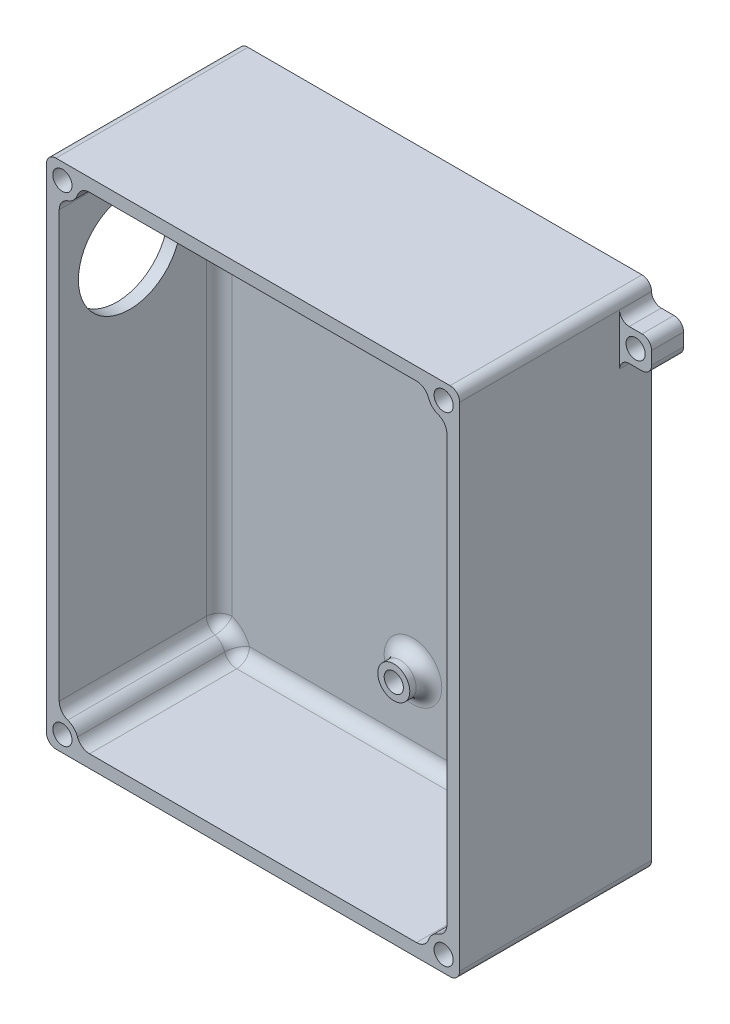
from build123d import *

# Parameters (mm, degrees)
SKETCH1_R          = 2.499999999999999
SKETCH1_W          = 60.58456356151953
SKETCH1_H          = 76
SKETCH1_R_2        = 1.5000000000000024
SKETCH1_R_3        = 1.5000000000000042
SKETCH1_R_4        = 2.500000000000004
BASE_DEPTH         = 5
WALLS_START        = 5
WALLS_DEPTH        = 25
STANDOFFS_START    = 5
SKETCH1_5_R        = 2.500000000000004
SKETCH1_5_R_2      = 1.5000000000000024
STANDOFFS_DEPTH    = 3
EXTERNAL_FILLET_R  = 1.5
INTERNAL_FILLET_R  = 2
SKETCH3_R          = 8.000000000000002
CUT_EXTRUDE2_DEPTH = 2


with BuildPart() as part:
    # Sketch1 → BASE (new body)
    # profile 1 of 51: a face of its own
    with BuildSketch(Plane.XY):
        with BuildLine():
            Line((-32.292281780759765, 39.999999999999986), (-32.292281780759765, 37.499999965069506))
            ThreePointArc((-32.292281780759765, 37.499999965069506), (-31.560048746075857, 39.267766940616646), (-29.79228178075956, 39.99999999999999))
            Line((-29.79228178075956, 39.99999999999999), (-32.292281780759765, 39.99999999999999))
        make_face()
    # profile 2 of 51: a face of its own
    with BuildSketch(Plane.XY):
        with BuildLine():
            ThreePointArc((-32.292281780759765, 37.499999965069506), (-31.728773442817484, 35.91886115638728), (-30.292281780759765, 35.050510257216814))
            Line((-30.292281780759765, 35.050510257216814), (-30.292281780759765, 36.085786437626865))
            ThreePointArc((-30.292281780759716, 36.08578643762688), (-30.85294195253962, 38.56066017177979), (-28.37806821838668, 38.000000000000014))
            Line((-28.378068218386687, 37.99999999999999), (-27.342792037976604, 37.99999999999999))
            ThreePointArc((-27.342792037976597, 38.00000000000002), (-28.21114295067551, 39.436491673103646), (-29.79228178075956, 39.99999999999999))
            ThreePointArc((-29.79228178075956, 39.99999999999999), (-31.560048746075857, 39.267766940616646), (-32.292281780759765, 37.499999965069506))
        make_face()
    # profile 3 of 51: a face of its own
    with BuildSketch(Plane.XY):
        with BuildLine():
            Line((-30.292281780759765, 36.085786437626865), (-30.292281780759765, 35.050510257216814))
            ThreePointArc((-30.292281780759765, 35.050510257216814), (-28.21114295067558, 35.56350832689628), (-27.29228178075977, 37.49999999999999))
            ThreePointArc((-27.29228178075977, 37.49999999999999), (-27.30494139824696, 37.751272405013026), (-27.342792037976597, 38.00000000000002))
            Line((-27.342792037976604, 37.99999999999999), (-28.378068218386687, 37.99999999999999))
            ThreePointArc((-28.37806821838668, 38.000000000000014), (-28.31388394127954, 37.75365296808865), (-28.29228178075977, 37.49999999999999))
            ThreePointArc((-28.29228178075977, 37.49999999999999), (-28.926256376975306, 36.27525512860842), (-30.292281780759716, 36.08578643762688))
        make_face()
    # profile 4 of 51: a face of its own
    with BuildSketch(Plane.XY):
        with BuildLine():
            Line((29.79228178075983, 40.00000000000002), (-29.79228178075956, 39.99999999999999))
            ThreePointArc((-29.79228178075956, 39.99999999999999), (-28.21114295067551, 39.436491673103646), (-27.342792037976597, 38.00000000000002))
            Line((-27.342792037976604, 37.99999999999999), (27.342792037976594, 37.99999999999999))
            ThreePointArc((27.342792037976594, 38.000000000000014), (28.211142950675608, 39.43649167310373), (29.79228178075983, 40))
        make_face()
    # profile 5 of 51: a face of its own
    with BuildSketch(Plane.XY):
        with BuildLine():
            Line((-32.292281780759765, -37.00000000000002), (-32.292281780759765, -37.49999999999999))
            ThreePointArc((-32.292281780759765, -37.49999999999999), (-31.728773453863475, -35.9188611699158), (-30.292281780759765, -35.050510257216814))
            Line((-30.292281780759765, -35.050510257216814), (-30.292281780759765, 35.050510257216814))
            ThreePointArc((-30.292281780759765, 35.050510257216814), (-31.728773442817484, 35.91886115638728), (-32.292281780759765, 37.499999965069506))
            Line((-32.292281780759765, 37.499999965069506), (-32.292281780759765, -32.000000000000014))
            Line((-32.292281780759765, -32.000000000000014), (-32.292281780759765, -37.00000000000002))
        make_face()
    # profile 6 of 51: a face of its own
    with BuildSketch(Plane.XY):
        with BuildLine():
            ThreePointArc((-32.292281780759765, 37.499999965069506), (-31.728773442817484, 35.91886115638728), (-30.292281780759765, 35.050510257216814))
            Line((-30.292281780759765, 35.050510257216814), (-30.292281780759765, 36.085786437626865))
            ThreePointArc((-30.292281780759716, 36.08578643762688), (-30.85294195253962, 38.56066017177979), (-28.37806821838668, 38.000000000000014))
            Line((-28.378068218386687, 37.99999999999999), (-27.342792037976604, 37.99999999999999))
            ThreePointArc((-27.342792037976597, 38.00000000000002), (-28.21114295067551, 39.436491673103646), (-29.79228178075956, 39.99999999999999))
            ThreePointArc((-29.79228178075956, 39.99999999999999), (-31.560048746075857, 39.267766940616646), (-32.292281780759765, 37.499999965069506))
        make_face()
    # profile 7 of 51: a face of its own
    with BuildSketch(Plane.XY):
        with BuildLine():
            Line((-30.292281780759765, 36.085786437626865), (-30.292281780759765, 35.050510257216814))
            ThreePointArc((-30.292281780759765, 35.050510257216814), (-28.21114295067558, 35.56350832689628), (-27.29228178075977, 37.49999999999999))
            ThreePointArc((-27.29228178075977, 37.49999999999999), (-27.30494139824696, 37.751272405013026), (-27.342792037976597, 38.00000000000002))
            Line((-27.342792037976604, 37.99999999999999), (-28.378068218386687, 37.99999999999999))
            ThreePointArc((-28.37806821838668, 38.000000000000014), (-28.31388394127954, 37.75365296808865), (-28.29228178075977, 37.49999999999999))
            ThreePointArc((-28.29228178075977, 37.49999999999999), (-28.926256376975306, 36.27525512860842), (-30.292281780759716, 36.08578643762688))
        make_face()
    # profile 8 of 51: a face of its own
    with BuildSketch(Plane.XY):
        with BuildLine():
            ThreePointArc((-32.292281780759765, -37.49999999999999), (-31.560048733726116, -39.26776695296638), (-29.79228178075971, -39.99999999999999))
            ThreePointArc((-29.79228178075971, -39.99999999999999), (-28.211142950675576, -39.436491673103696), (-27.3427920379766, -38.00000000000004))
            Line((-27.342792037976608, -38.000000000000014), (-28.37806821838667, -38.000000000000014))
            ThreePointArc((-28.378068218386662, -38.000000000000036), (-30.85294195253959, -38.56066017177981), (-30.29228178075972, -36.0857864376269))
            Line((-30.292281780759765, -36.085786437626886), (-30.292281780759765, -35.050510257216814))
            ThreePointArc((-30.292281780759765, -35.050510257216814), (-31.728773453863475, -35.9188611699158), (-32.292281780759765, -37.49999999999999))
        make_face()
    # profile 9 of 51: a face of its own
    with BuildSketch(Plane.XY):
        with BuildLine():
            Line((-28.37806821838667, -38.000000000000014), (-27.342792037976608, -38.000000000000014))
            ThreePointArc((-27.3427920379766, -38.00000000000004), (-27.304941398246964, -37.75127240501304), (-27.29228178075977, -37.49999999999999))
            ThreePointArc((-27.29228178075977, -37.49999999999999), (-28.21114295067558, -35.56350832689628), (-30.292281780759765, -35.050510257216814))
            Line((-30.292281780759765, -35.050510257216814), (-30.292281780759765, -36.085786437626886))
            ThreePointArc((-30.29228178075972, -36.0857864376269), (-28.926256376975296, -36.27525512860843), (-28.292281780759748, -37.50000000000001))
            ThreePointArc((-28.292281780759748, -37.50000000000001), (-28.313883941279517, -37.753652968088666), (-28.378068218386662, -38.000000000000036))
        make_face()
    # profile 10 of 51: a face of its own
    with BuildSketch(Plane.XY):
        with BuildLine():
            Line((-32.292281780759765, -37.49999999999999), (-32.292281780759765, -40.000000000000014))
            Line((-32.292281780759765, -40.000000000000014), (-29.79228178075971, -40.000000000000014))
            ThreePointArc((-29.79228178075971, -39.99999999999999), (-31.560048733726116, -39.26776695296638), (-32.292281780759765, -37.49999999999999))
        make_face()
    # profile 11 of 51: a face of its own
    with BuildSketch(Plane.XY):
        with BuildLine():
            ThreePointArc((-32.292281780759765, -37.49999999999999), (-31.560048733726116, -39.26776695296638), (-29.79228178075971, -39.99999999999999))
            ThreePointArc((-29.79228178075971, -39.99999999999999), (-28.211142950675576, -39.436491673103696), (-27.3427920379766, -38.00000000000004))
            Line((-27.342792037976608, -38.000000000000014), (-28.37806821838667, -38.000000000000014))
            ThreePointArc((-28.378068218386662, -38.000000000000036), (-30.85294195253959, -38.56066017177981), (-30.29228178075972, -36.0857864376269))
            Line((-30.292281780759765, -36.085786437626886), (-30.292281780759765, -35.050510257216814))
            ThreePointArc((-30.292281780759765, -35.050510257216814), (-31.728773453863475, -35.9188611699158), (-32.292281780759765, -37.49999999999999))
        make_face()
    # profile 12 of 51: a face of its own
    with BuildSketch(Plane.XY):
        with BuildLine():
            Line((-28.37806821838667, -38.000000000000014), (-27.342792037976608, -38.000000000000014))
            ThreePointArc((-27.3427920379766, -38.00000000000004), (-27.304941398246964, -37.75127240501304), (-27.29228178075977, -37.49999999999999))
            ThreePointArc((-27.29228178075977, -37.49999999999999), (-28.21114295067558, -35.56350832689628), (-30.292281780759765, -35.050510257216814))
            Line((-30.292281780759765, -35.050510257216814), (-30.292281780759765, -36.085786437626886))
            ThreePointArc((-30.29228178075972, -36.0857864376269), (-28.926256376975296, -36.27525512860843), (-28.292281780759748, -37.50000000000001))
            ThreePointArc((-28.292281780759748, -37.50000000000001), (-28.313883941279517, -37.753652968088666), (-28.378068218386662, -38.000000000000036))
        make_face()
    # profile 13 of 51: a face of its own
    with BuildSketch(Plane.XY):
        with BuildLine():
            ThreePointArc((-27.3427920379766, -38.00000000000004), (-28.211142950675576, -39.436491673103696), (-29.79228178075971, -39.99999999999999))
            Line((-29.79228178075971, -40.000000000000014), (29.792281775663405, -39.99999999999997))
            ThreePointArc((29.792281775663405, -40), (28.21114294870178, -39.43649167149211), (27.3427920379766, -38.000000000000036))
            Line((27.342792037976608, -38.000000000000014), (-27.342792037976608, -38.000000000000014))
        make_face()
    # profile 14 of 51: a face of its own
    with BuildSketch(Plane.XY):
        with BuildLine():
            ThreePointArc((27.3427920379766, -38.000000000000036), (28.21114294870178, -39.43649167149211), (29.792281775663405, -40))
            ThreePointArc((29.792281775663405, -40), (31.5600487319243, -39.267766954768206), (32.292281780759765, -37.5))
            ThreePointArc((32.292281780759765, -37.5), (31.728773453863468, -35.9188611699158), (30.292281780759744, -35.050510257216814))
            Line((30.292281780759765, -35.050510257216814), (30.292281780759765, -36.085786437626886))
            ThreePointArc((30.292281780759733, -36.08578643762689), (31.017026652151344, -36.633974596215545), (31.292281780759765, -37.5))
            ThreePointArc((31.292281780759765, -37.5), (30.04593474884841, -38.97839783948023), (28.378068218386677, -38))
            Line((28.378068218386673, -38.000000000000014), (27.342792037976608, -38.000000000000014))
        make_face()
    # profile 15 of 51: a face of its own
    with BuildSketch(Plane.XY):
        with BuildLine():
            ThreePointArc((30.292281780759744, -35.050510257216814), (28.02451482779338, -35.73223304703365), (27.3427920379766, -38.000000000000036))
            Line((27.342792037976608, -38.000000000000014), (28.378068218386673, -38.000000000000014))
            ThreePointArc((28.378068218386677, -38), (28.731621608979935, -36.43933982822019), (30.292281780759733, -36.08578643762689))
            Line((30.292281780759765, -36.085786437626886), (30.292281780759765, -35.050510257216814))
        make_face()
    # profile 16 of 51: a face of its own
    with BuildSketch(Plane.XY):
        with BuildLine():
            ThreePointArc((32.292281780759765, -37.5), (31.5600487319243, -39.267766954768206), (29.792281775663405, -40))
            Line((29.792281775663405, -39.99999999999997), (32.292281780759765, -39.99999999999997))
            Line((32.292281780759765, -39.99999999999997), (32.292281780759765, -37.5))
        make_face()
    # profile 17 of 51: a face of its own
    with BuildSketch(Plane.XY):
        with BuildLine():
            ThreePointArc((30.292281780759744, -35.050510257216814), (31.728773453863468, -35.9188611699158), (32.292281780759765, -37.5))
            Line((32.292281780759765, -37.5), (32.292281780759765, 32))
            Line((32.292281780759765, 32), (32.292281780759765, 36.99999999999996))
            Line((32.292281780759765, 36.99999999999996), (32.292281780759765, 37.5))
            ThreePointArc((32.292281780759765, 37.5), (31.728773453863468, 35.9188611699158), (30.292281780759748, 35.05051025721682))
            Line((30.292281780759765, 35.050510257216814), (30.292281780759765, -35.050510257216814))
        make_face()
    # profile 18 of 51: a face of its own
    with BuildSketch(Plane.XY):
        with BuildLine():
            ThreePointArc((27.3427920379766, -38.000000000000036), (28.21114294870178, -39.43649167149211), (29.792281775663405, -40))
            ThreePointArc((29.792281775663405, -40), (31.5600487319243, -39.267766954768206), (32.292281780759765, -37.5))
            ThreePointArc((32.292281780759765, -37.5), (31.728773453863468, -35.9188611699158), (30.292281780759744, -35.050510257216814))
            Line((30.292281780759765, -35.050510257216814), (30.292281780759765, -36.085786437626886))
            ThreePointArc((30.292281780759733, -36.08578643762689), (31.017026652151344, -36.633974596215545), (31.292281780759765, -37.5))
            ThreePointArc((31.292281780759765, -37.5), (30.04593474884841, -38.97839783948023), (28.378068218386677, -38))
            Line((28.378068218386673, -38.000000000000014), (27.342792037976608, -38.000000000000014))
        make_face()
    # profile 19 of 51: a face of its own
    with BuildSketch(Plane.XY):
        with BuildLine():
            ThreePointArc((30.292281780759744, -35.050510257216814), (28.02451482779338, -35.73223304703365), (27.3427920379766, -38.000000000000036))
            Line((27.342792037976608, -38.000000000000014), (28.378068218386673, -38.000000000000014))
            ThreePointArc((28.378068218386677, -38), (28.731621608979935, -36.43933982822019), (30.292281780759733, -36.08578643762689))
            Line((30.292281780759765, -36.085786437626886), (30.292281780759765, -35.050510257216814))
        make_face()
    # profile 20 of 51: a face of its own
    with BuildSketch(Plane.XY):
        with Locations((-29.79228178075977, -37.49999999999999)):
            Circle(SKETCH1_R)
    # profile 21 of 51: a face of its own
    with BuildSketch(Plane.XY):
        with Locations((29.79228178075977, -37.5)):
            Circle(SKETCH1_R)
    # profile 22 of 51: a face of its own
    with BuildSketch(Plane.XY):
        with Locations((29.79228178075977, 37.5)):
            Circle(SKETCH1_R)
    # profile 23 of 51: a face of its own
    with BuildSketch(Plane.XY):
        with Locations((-29.79228178075977, 37.49999999999999)):
            Circle(SKETCH1_R)
    # profile 24 of 51: a face of its own
    with BuildSketch(Plane.XY):
        Rectangle(SKETCH1_W, SKETCH1_H)
        with Locations((8.15e-15, -26.543)):
            Circle(SKETCH1_R_2, mode=Mode.SUBTRACT)
        with Locations((1.65e-15, 26.542999999999992)):
            Circle(SKETCH1_R_2, mode=Mode.SUBTRACT)
    # profile 25 of 51: a face of its own
    with BuildSketch(Plane.XY):
        with BuildLine():
            ThreePointArc((29.79228178075983, 40), (31.56004873372616, 39.26776695296635), (32.292281780759765, 37.5))
            Line((32.292281780759765, 37.5), (32.292281780759765, 40.00000000000003))
            Line((32.292281780759765, 40.00000000000002), (29.79228178075983, 40.00000000000002))
        make_face()
    # profile 26 of 51: a face of its own
    with BuildSketch(Plane.XY):
        with BuildLine():
            ThreePointArc((27.342792037976594, 38.000000000000014), (28.02451482779339, 35.732233047033645), (30.292281780759748, 35.05051025721682))
            Line((30.292281780759765, 35.050510257216814), (30.292281780759765, 36.08578643762688))
            ThreePointArc((30.29228178075973, 36.08578643762689), (28.731621608979946, 36.439339828220184), (28.378068218386666, 37.99999999999997))
            Line((28.37806821838666, 37.99999999999999), (27.342792037976594, 37.99999999999999))
        make_face()
    # profile 27 of 51: a face of its own
    with BuildSketch(Plane.XY):
        with BuildLine():
            Line((30.292281780759765, 36.08578643762688), (30.292281780759765, 35.050510257216814))
            ThreePointArc((30.292281780759748, 35.05051025721682), (31.728773453863468, 35.9188611699158), (32.292281780759765, 37.5))
            ThreePointArc((32.292281780759765, 37.5), (31.56004873372616, 39.26776695296635), (29.79228178075983, 40))
            ThreePointArc((29.79228178075983, 40), (28.211142950675608, 39.43649167310373), (27.342792037976594, 38.000000000000014))
            Line((27.342792037976594, 37.99999999999999), (28.37806821838666, 37.99999999999999))
            ThreePointArc((28.378068218386666, 37.99999999999997), (30.045934748848396, 38.97839783948023), (31.292281780759765, 37.5))
            ThreePointArc((31.292281780759765, 37.5), (31.017026652151344, 36.633974596215545), (30.29228178075973, 36.08578643762689))
        make_face()
    # profile 28 of 51: a face of its own
    with BuildSketch(Plane.XY):
        with BuildLine():
            ThreePointArc((27.342792037976594, 38.000000000000014), (28.02451482779339, 35.732233047033645), (30.292281780759748, 35.05051025721682))
            Line((30.292281780759765, 35.050510257216814), (30.292281780759765, 36.08578643762688))
            ThreePointArc((30.29228178075973, 36.08578643762689), (28.731621608979946, 36.439339828220184), (28.378068218386666, 37.99999999999997))
            Line((28.37806821838666, 37.99999999999999), (27.342792037976594, 37.99999999999999))
        make_face()
    # profile 29 of 51: a face of its own
    with BuildSketch(Plane.XY):
        with BuildLine():
            Line((30.292281780759765, 36.08578643762688), (30.292281780759765, 35.050510257216814))
            ThreePointArc((30.292281780759748, 35.05051025721682), (31.728773453863468, 35.9188611699158), (32.292281780759765, 37.5))
            ThreePointArc((32.292281780759765, 37.5), (31.56004873372616, 39.26776695296635), (29.79228178075983, 40))
            ThreePointArc((29.79228178075983, 40), (28.211142950675608, 39.43649167310373), (27.342792037976594, 38.000000000000014))
            Line((27.342792037976594, 37.99999999999999), (28.37806821838666, 37.99999999999999))
            ThreePointArc((28.378068218386666, 37.99999999999997), (30.045934748848396, 38.97839783948023), (31.292281780759765, 37.5))
            ThreePointArc((31.292281780759765, 37.5), (31.017026652151344, 36.633974596215545), (30.29228178075973, 36.08578643762689))
        make_face()
    # profile 30 of 51: a face of its own
    with BuildSketch(Plane.XY):
        Polygon((32.292281780759765, 36.99999999999996), (32.292281780759765, 32), (37.29228178075976, 31.99999999999998), (37.29228178075976, 36.99999999999998), align=None)
        with Locations((34.79228178075976, 34.49999999999998)):
            Circle(SKETCH1_R_3, mode=Mode.SUBTRACT)
    # profile 31 of 51: a face of its own
    with BuildSketch(Plane.XY):
        Polygon((-37.29228178075977, -37.00000000000002), (-32.29228178075977, -37.00000000000002), (-32.292281780759765, -32.000000000000014), (-37.29228178075977, -32.000000000000014), align=None)
        with Locations((-34.79228178075977, -34.500000000000014)):
            Circle(SKETCH1_R_3, mode=Mode.SUBTRACT)
    # profile 32 of 51: a face of its own
    with BuildSketch(Plane.XY):
        with BuildLine():
            ThreePointArc((-28.37806821838668, 38.000000000000014), (-30.85294195253962, 38.56066017177979), (-30.292281780759716, 36.08578643762688))
            Line((-30.292281780759765, 36.085786437626865), (-30.292281780759765, 37.999999999999986))
            Line((-30.292281780759765, 37.99999999999999), (-28.378068218386687, 37.99999999999999))
        make_face()
    # profile 33 of 51: a face of its own
    with BuildSketch(Plane.XY):
        with BuildLine():
            Line((-30.292281780759765, 37.999999999999986), (-30.292281780759765, 36.085786437626865))
            ThreePointArc((-30.292281780759716, 36.08578643762688), (-28.926256376975306, 36.27525512860842), (-28.29228178075977, 37.49999999999999))
            ThreePointArc((-28.29228178075977, 37.49999999999999), (-28.31388394127954, 37.75365296808865), (-28.37806821838668, 38.000000000000014))
            Line((-28.378068218386687, 37.99999999999999), (-30.292281780759765, 37.99999999999999))
        make_face()
    # profile 34 of 51: a face of its own
    with BuildSketch(Plane.XY):
        with BuildLine():
            ThreePointArc((28.378068218386666, 37.99999999999997), (28.731621608979946, 36.439339828220184), (30.29228178075973, 36.08578643762689))
            Line((30.292281780759765, 36.08578643762688), (30.292281780759765, 37.999999999999986))
            Line((30.292281780759765, 37.99999999999999), (28.37806821838666, 37.99999999999999))
        make_face()
    # profile 35 of 51: a face of its own
    with BuildSketch(Plane.XY):
        with BuildLine():
            Line((30.292281780759765, 37.999999999999986), (30.292281780759765, 36.08578643762688))
            ThreePointArc((30.29228178075973, 36.08578643762689), (31.017026652151344, 36.633974596215545), (31.292281780759765, 37.5))
            ThreePointArc((31.292281780759765, 37.5), (30.045934748848396, 38.97839783948023), (28.378068218386666, 37.99999999999997))
            Line((28.37806821838666, 37.99999999999999), (30.292281780759765, 37.99999999999999))
        make_face()
    # profile 36 of 51: a face of its own
    with BuildSketch(Plane.XY):
        with BuildLine():
            ThreePointArc((30.292281780759733, -36.08578643762689), (28.731621608979935, -36.43933982822019), (28.378068218386677, -38))
            Line((28.378068218386673, -38.000000000000014), (30.292281780759765, -38.000000000000014))
            Line((30.292281780759765, -38.000000000000014), (30.292281780759765, -36.085786437626886))
        make_face()
    # profile 37 of 51: a face of its own
    with BuildSketch(Plane.XY):
        with BuildLine():
            Line((30.292281780759765, -38.000000000000014), (28.378068218386673, -38.000000000000014))
            ThreePointArc((28.378068218386677, -38), (30.04593474884841, -38.97839783948023), (31.292281780759765, -37.5))
            ThreePointArc((31.292281780759765, -37.5), (31.017026652151344, -36.633974596215545), (30.292281780759733, -36.08578643762689))
            Line((30.292281780759765, -36.085786437626886), (30.292281780759765, -38.000000000000014))
        make_face()
    # profile 38 of 51: a face of its own
    with BuildSketch(Plane.XY):
        with BuildLine():
            ThreePointArc((30.292281780759733, -36.08578643762689), (28.731621608979935, -36.43933982822019), (28.378068218386677, -38))
            Line((28.378068218386673, -38.000000000000014), (30.292281780759765, -38.000000000000014))
            Line((30.292281780759765, -38.000000000000014), (30.292281780759765, -36.085786437626886))
        make_face()
    # profile 39 of 51: a face of its own
    with BuildSketch(Plane.XY):
        with BuildLine():
            Line((30.292281780759765, -38.000000000000014), (28.378068218386673, -38.000000000000014))
            ThreePointArc((28.378068218386677, -38), (30.04593474884841, -38.97839783948023), (31.292281780759765, -37.5))
            ThreePointArc((31.292281780759765, -37.5), (31.017026652151344, -36.633974596215545), (30.292281780759733, -36.08578643762689))
            Line((30.292281780759765, -36.085786437626886), (30.292281780759765, -38.000000000000014))
        make_face()
    # profile 40 of 51: a face of its own
    with BuildSketch(Plane.XY):
        with BuildLine():
            ThreePointArc((28.378068218386666, 37.99999999999997), (28.731621608979946, 36.439339828220184), (30.29228178075973, 36.08578643762689))
            Line((30.292281780759765, 36.08578643762688), (30.292281780759765, 37.999999999999986))
            Line((30.292281780759765, 37.99999999999999), (28.37806821838666, 37.99999999999999))
        make_face()
    # profile 41 of 51: a face of its own
    with BuildSketch(Plane.XY):
        with BuildLine():
            Line((30.292281780759765, 37.999999999999986), (30.292281780759765, 36.08578643762688))
            ThreePointArc((30.29228178075973, 36.08578643762689), (31.017026652151344, 36.633974596215545), (31.292281780759765, 37.5))
            ThreePointArc((31.292281780759765, 37.5), (30.045934748848396, 38.97839783948023), (28.378068218386666, 37.99999999999997))
            Line((28.37806821838666, 37.99999999999999), (30.292281780759765, 37.99999999999999))
        make_face()
    # profile 42 of 51: a face of its own
    with BuildSketch(Plane.XY):
        with BuildLine():
            ThreePointArc((-28.37806821838668, 38.000000000000014), (-30.85294195253962, 38.56066017177979), (-30.292281780759716, 36.08578643762688))
            Line((-30.292281780759765, 36.085786437626865), (-30.292281780759765, 37.999999999999986))
            Line((-30.292281780759765, 37.99999999999999), (-28.378068218386687, 37.99999999999999))
        make_face()
    # profile 43 of 51: a face of its own
    with BuildSketch(Plane.XY):
        with BuildLine():
            Line((-30.292281780759765, 37.999999999999986), (-30.292281780759765, 36.085786437626865))
            ThreePointArc((-30.292281780759716, 36.08578643762688), (-28.926256376975306, 36.27525512860842), (-28.29228178075977, 37.49999999999999))
            ThreePointArc((-28.29228178075977, 37.49999999999999), (-28.31388394127954, 37.75365296808865), (-28.37806821838668, 38.000000000000014))
            Line((-28.378068218386687, 37.99999999999999), (-30.292281780759765, 37.99999999999999))
        make_face()
    # profile 44 of 51: a face of its own
    with BuildSketch(Plane.XY):
        with BuildLine():
            ThreePointArc((-30.29228178075972, -36.0857864376269), (-30.85294195253959, -38.56066017177981), (-28.378068218386662, -38.000000000000036))
            Line((-28.37806821838667, -38.000000000000014), (-30.292281780759765, -38.000000000000014))
            Line((-30.292281780759765, -38.000000000000014), (-30.292281780759765, -36.085786437626886))
        make_face()
    # profile 45 of 51: a face of its own
    with BuildSketch(Plane.XY):
        with BuildLine():
            Line((-30.292281780759765, -38.000000000000014), (-28.37806821838667, -38.000000000000014))
            ThreePointArc((-28.378068218386662, -38.000000000000036), (-28.313883941279517, -37.753652968088666), (-28.292281780759748, -37.50000000000001))
            ThreePointArc((-28.292281780759748, -37.50000000000001), (-28.926256376975296, -36.27525512860843), (-30.29228178075972, -36.0857864376269))
            Line((-30.292281780759765, -36.085786437626886), (-30.292281780759765, -38.000000000000014))
        make_face()
    # profile 46 of 51: a face of its own
    with BuildSketch(Plane.XY):
        with BuildLine():
            ThreePointArc((-30.29228178075972, -36.0857864376269), (-30.85294195253959, -38.56066017177981), (-28.378068218386662, -38.000000000000036))
            Line((-28.37806821838667, -38.000000000000014), (-30.292281780759765, -38.000000000000014))
            Line((-30.292281780759765, -38.000000000000014), (-30.292281780759765, -36.085786437626886))
        make_face()
    # profile 47 of 51: a face of its own
    with BuildSketch(Plane.XY):
        with BuildLine():
            Line((-30.292281780759765, -38.000000000000014), (-28.37806821838667, -38.000000000000014))
            ThreePointArc((-28.378068218386662, -38.000000000000036), (-28.313883941279517, -37.753652968088666), (-28.292281780759748, -37.50000000000001))
            ThreePointArc((-28.292281780759748, -37.50000000000001), (-28.926256376975296, -36.27525512860843), (-30.29228178075972, -36.0857864376269))
            Line((-30.292281780759765, -36.085786437626886), (-30.292281780759765, -38.000000000000014))
        make_face()
    # profile 48 of 51: a face of its own
    with BuildSketch(Plane.XY):
        with Locations((1.65e-15, 26.542999999999992)):
            Circle(SKETCH1_R_4)
        with Locations((1.65e-15, 26.542999999999992)):
            Circle(SKETCH1_R_2, mode=Mode.SUBTRACT)
    # profile 49 of 51: a face of its own
    with BuildSketch(Plane.XY):
        with Locations((1.65e-15, 26.542999999999992)):
            Circle(SKETCH1_R_2)
    # profile 50 of 51: a face of its own
    with BuildSketch(Plane.XY):
        with Locations((8.15e-15, -26.543)):
            Circle(SKETCH1_R_4)
        with Locations((8.15e-15, -26.543)):
            Circle(SKETCH1_R_2, mode=Mode.SUBTRACT)
    # profile 51 of 51: a face of its own
    with BuildSketch(Plane.XY):
        with Locations((8.15e-15, -26.543)):
            Circle(SKETCH1_R_2)
    extrude(amount=BASE_DEPTH)

    # Sketch1<3> → WALLS (add)
    with BuildSketch(Plane.XY.offset(WALLS_START)):
        with BuildLine():
            Line((29.79228178075983, 40.00000000000002), (-29.79228178075956, 39.99999999999999))
            ThreePointArc((-29.79228178075956, 39.99999999999999), (-28.21114295067551, 39.436491673103646), (-27.342792037976597, 38.00000000000002))
            Line((-27.342792037976604, 37.99999999999999), (27.342792037976594, 37.99999999999999))
            ThreePointArc((27.342792037976594, 38.000000000000014), (28.211142950675608, 39.43649167310373), (29.79228178075983, 40))
        make_face()
        with BuildLine():
            ThreePointArc((-32.292281780759765, 37.499999965069506), (-31.728773442817484, 35.91886115638728), (-30.292281780759765, 35.050510257216814))
            Line((-30.292281780759765, 35.050510257216814), (-30.292281780759765, 36.085786437626865))
            ThreePointArc((-30.292281780759716, 36.08578643762688), (-30.85294195253962, 38.56066017177979), (-28.37806821838668, 38.000000000000014))
            Line((-28.378068218386687, 37.99999999999999), (-27.342792037976604, 37.99999999999999))
            ThreePointArc((-27.342792037976597, 38.00000000000002), (-28.21114295067551, 39.436491673103646), (-29.79228178075956, 39.99999999999999))
            ThreePointArc((-29.79228178075956, 39.99999999999999), (-31.560048746075857, 39.267766940616646), (-32.292281780759765, 37.499999965069506))
        make_face()
        with BuildLine():
            Line((-30.292281780759765, 36.085786437626865), (-30.292281780759765, 35.050510257216814))
            ThreePointArc((-30.292281780759765, 35.050510257216814), (-28.21114295067558, 35.56350832689628), (-27.29228178075977, 37.49999999999999))
            ThreePointArc((-27.29228178075977, 37.49999999999999), (-27.30494139824696, 37.751272405013026), (-27.342792037976597, 38.00000000000002))
            Line((-27.342792037976604, 37.99999999999999), (-28.378068218386687, 37.99999999999999))
            ThreePointArc((-28.37806821838668, 38.000000000000014), (-28.31388394127954, 37.75365296808865), (-28.29228178075977, 37.49999999999999))
            ThreePointArc((-28.29228178075977, 37.49999999999999), (-28.926256376975306, 36.27525512860842), (-30.292281780759716, 36.08578643762688))
        make_face()
        with BuildLine():
            Line((-32.292281780759765, 39.999999999999986), (-32.292281780759765, 37.499999965069506))
            ThreePointArc((-32.292281780759765, 37.499999965069506), (-31.560048746075857, 39.267766940616646), (-29.79228178075956, 39.99999999999999))
            Line((-29.79228178075956, 39.99999999999999), (-32.292281780759765, 39.99999999999999))
        make_face()
        with BuildLine():
            Line((-32.292281780759765, -37.00000000000002), (-32.292281780759765, -37.49999999999999))
            ThreePointArc((-32.292281780759765, -37.49999999999999), (-31.728773453863475, -35.9188611699158), (-30.292281780759765, -35.050510257216814))
            Line((-30.292281780759765, -35.050510257216814), (-30.292281780759765, 35.050510257216814))
            ThreePointArc((-30.292281780759765, 35.050510257216814), (-31.728773442817484, 35.91886115638728), (-32.292281780759765, 37.499999965069506))
            Line((-32.292281780759765, 37.499999965069506), (-32.292281780759765, -32.000000000000014))
            Line((-32.292281780759765, -32.000000000000014), (-32.292281780759765, -37.00000000000002))
        make_face()
        with BuildLine():
            ThreePointArc((-32.292281780759765, -37.49999999999999), (-31.560048733726116, -39.26776695296638), (-29.79228178075971, -39.99999999999999))
            ThreePointArc((-29.79228178075971, -39.99999999999999), (-28.211142950675576, -39.436491673103696), (-27.3427920379766, -38.00000000000004))
            Line((-27.342792037976608, -38.000000000000014), (-28.37806821838667, -38.000000000000014))
            ThreePointArc((-28.378068218386662, -38.000000000000036), (-30.85294195253959, -38.56066017177981), (-30.29228178075972, -36.0857864376269))
            Line((-30.292281780759765, -36.085786437626886), (-30.292281780759765, -35.050510257216814))
            ThreePointArc((-30.292281780759765, -35.050510257216814), (-31.728773453863475, -35.9188611699158), (-32.292281780759765, -37.49999999999999))
        make_face()
        with BuildLine():
            Line((-28.37806821838667, -38.000000000000014), (-27.342792037976608, -38.000000000000014))
            ThreePointArc((-27.3427920379766, -38.00000000000004), (-27.304941398246964, -37.75127240501304), (-27.29228178075977, -37.49999999999999))
            ThreePointArc((-27.29228178075977, -37.49999999999999), (-28.21114295067558, -35.56350832689628), (-30.292281780759765, -35.050510257216814))
            Line((-30.292281780759765, -35.050510257216814), (-30.292281780759765, -36.085786437626886))
            ThreePointArc((-30.29228178075972, -36.0857864376269), (-28.926256376975296, -36.27525512860843), (-28.292281780759748, -37.50000000000001))
            ThreePointArc((-28.292281780759748, -37.50000000000001), (-28.313883941279517, -37.753652968088666), (-28.378068218386662, -38.000000000000036))
        make_face()
        with BuildLine():
            Line((-32.292281780759765, -37.49999999999999), (-32.292281780759765, -40.000000000000014))
            Line((-32.292281780759765, -40.000000000000014), (-29.79228178075971, -40.000000000000014))
            ThreePointArc((-29.79228178075971, -39.99999999999999), (-31.560048733726116, -39.26776695296638), (-32.292281780759765, -37.49999999999999))
        make_face()
        with BuildLine():
            ThreePointArc((-27.3427920379766, -38.00000000000004), (-28.211142950675576, -39.436491673103696), (-29.79228178075971, -39.99999999999999))
            Line((-29.79228178075971, -40.000000000000014), (29.792281775663405, -39.99999999999997))
            ThreePointArc((29.792281775663405, -40), (28.21114294870178, -39.43649167149211), (27.3427920379766, -38.000000000000036))
            Line((27.342792037976608, -38.000000000000014), (-27.342792037976608, -38.000000000000014))
        make_face()
        with BuildLine():
            ThreePointArc((27.3427920379766, -38.000000000000036), (28.21114294870178, -39.43649167149211), (29.792281775663405, -40))
            ThreePointArc((29.792281775663405, -40), (31.5600487319243, -39.267766954768206), (32.292281780759765, -37.5))
            ThreePointArc((32.292281780759765, -37.5), (31.728773453863468, -35.9188611699158), (30.292281780759744, -35.050510257216814))
            Line((30.292281780759765, -35.050510257216814), (30.292281780759765, -36.085786437626886))
            ThreePointArc((30.292281780759733, -36.08578643762689), (31.017026652151344, -36.633974596215545), (31.292281780759765, -37.5))
            ThreePointArc((31.292281780759765, -37.5), (30.04593474884841, -38.97839783948023), (28.378068218386677, -38))
            Line((28.378068218386673, -38.000000000000014), (27.342792037976608, -38.000000000000014))
        make_face()
        with BuildLine():
            ThreePointArc((30.292281780759744, -35.050510257216814), (28.02451482779338, -35.73223304703365), (27.3427920379766, -38.000000000000036))
            Line((27.342792037976608, -38.000000000000014), (28.378068218386673, -38.000000000000014))
            ThreePointArc((28.378068218386677, -38), (28.731621608979935, -36.43933982822019), (30.292281780759733, -36.08578643762689))
            Line((30.292281780759765, -36.085786437626886), (30.292281780759765, -35.050510257216814))
        make_face()
        with BuildLine():
            ThreePointArc((32.292281780759765, -37.5), (31.5600487319243, -39.267766954768206), (29.792281775663405, -40))
            Line((29.792281775663405, -39.99999999999997), (32.292281780759765, -39.99999999999997))
            Line((32.292281780759765, -39.99999999999997), (32.292281780759765, -37.5))
        make_face()
        with BuildLine():
            ThreePointArc((30.292281780759744, -35.050510257216814), (31.728773453863468, -35.9188611699158), (32.292281780759765, -37.5))
            Line((32.292281780759765, -37.5), (32.292281780759765, 32))
            Line((32.292281780759765, 32), (32.292281780759765, 36.99999999999996))
            Line((32.292281780759765, 36.99999999999996), (32.292281780759765, 37.5))
            ThreePointArc((32.292281780759765, 37.5), (31.728773453863468, 35.9188611699158), (30.292281780759748, 35.05051025721682))
            Line((30.292281780759765, 35.050510257216814), (30.292281780759765, -35.050510257216814))
        make_face()
        with BuildLine():
            ThreePointArc((27.342792037976594, 38.000000000000014), (28.02451482779339, 35.732233047033645), (30.292281780759748, 35.05051025721682))
            Line((30.292281780759765, 35.050510257216814), (30.292281780759765, 36.08578643762688))
            ThreePointArc((30.29228178075973, 36.08578643762689), (28.731621608979946, 36.439339828220184), (28.378068218386666, 37.99999999999997))
            Line((28.37806821838666, 37.99999999999999), (27.342792037976594, 37.99999999999999))
        make_face()
        with BuildLine():
            Line((30.292281780759765, 36.08578643762688), (30.292281780759765, 35.050510257216814))
            ThreePointArc((30.292281780759748, 35.05051025721682), (31.728773453863468, 35.9188611699158), (32.292281780759765, 37.5))
            ThreePointArc((32.292281780759765, 37.5), (31.56004873372616, 39.26776695296635), (29.79228178075983, 40))
            ThreePointArc((29.79228178075983, 40), (28.211142950675608, 39.43649167310373), (27.342792037976594, 38.000000000000014))
            Line((27.342792037976594, 37.99999999999999), (28.37806821838666, 37.99999999999999))
            ThreePointArc((28.378068218386666, 37.99999999999997), (30.045934748848396, 38.97839783948023), (31.292281780759765, 37.5))
            ThreePointArc((31.292281780759765, 37.5), (31.017026652151344, 36.633974596215545), (30.29228178075973, 36.08578643762689))
        make_face()
        with BuildLine():
            ThreePointArc((29.79228178075983, 40), (31.56004873372616, 39.26776695296635), (32.292281780759765, 37.5))
            Line((32.292281780759765, 37.5), (32.292281780759765, 40.00000000000003))
            Line((32.292281780759765, 40.00000000000002), (29.79228178075983, 40.00000000000002))
        make_face()
    extrude(amount=WALLS_DEPTH)

    # Sketch1<5> → STANDOFFs (add)
    # profile 1 of 2: a face of its own
    with BuildSketch(Plane.XY.offset(STANDOFFS_START)):
        with Locations((8.15e-15, -26.543)):
            Circle(SKETCH1_5_R)
        with Locations((8.15e-15, -26.543)):
            Circle(SKETCH1_5_R_2, mode=Mode.SUBTRACT)
    # profile 2 of 2: a face of its own
    with BuildSketch(Plane.XY.offset(STANDOFFS_START)):
        with Locations((1.65e-15, 26.542999999999992)):
            Circle(SKETCH1_5_R)
        with Locations((1.65e-15, 26.542999999999992)):
            Circle(SKETCH1_5_R_2, mode=Mode.SUBTRACT)
    extrude(amount=STANDOFFS_DEPTH)

    # External Fillet
    external_fillet_edges = [part.edges().sort_by_distance(p)[0] for p in [
        (-32.292281780759765, -37.00000000000002, 2.5),
        (-37.29228178075977, -37.00000000000002, 2.5),
        (-37.29228178075977, -32.000000000000014, 2.5),
        (-32.292281780759765, -32.000000000000014, 2.5),
        (-32.292281780759765, 39.999999999999986, 15),
        (32.292281780759765, 40.00000000000003, 15),
        (32.29228178075976, 36.99999999999996, 2.5),
        (37.29228178075976, 36.99999999999998, 2.5),
        (37.29228178075976, 31.99999999999998, 2.5),
        (32.29228178075976, 32, 2.5),
        (32.292281780759765, -39.99999999999997, 15),
        (-32.292281780759765, -40.000000000000014, 15),
    ]]
    fillet(external_fillet_edges, radius=EXTERNAL_FILLET_R - 0.0001)  # a hair under: the kernel refuses the full size

    # Internal Fillet
    internal_fillet_edges = [part.edges().sort_by_distance(p)[0] for p in [
        (-2.499999999999996, -26.543, 5),
        (-2.500000000000002, 26.542999999999992, 5),
        (0, 38, 5),
        (-30.292281780759755, 0, 5),
        (28.02451482779338, -35.73223304703365, 5),
        (30.292281780759755, -35.050510257216814, 17.5),
        (30.292281780759765, 0, 5),
        (30.292281780759758, 35.050510257216814, 17.5),
        (28.02451482779339, 35.732233047033645, 5),
        (27.342792037976594, 38, 17.5),
        (-27.3427920379766, 38.00000000000001, 17.5),
        (-28.024514827793393, 35.73223304703363, 5),
        (-30.292281780759765, 35.050510257216814, 17.5),
        (-30.292281780759765, -35.050510257216814, 17.5),
        (-28.02451482779338, -35.73223304703336, 5),
        (-27.342792037976608, -38.00000000000003, 17.5),
        (-3.55e-15, -38.00000000000002, 5),
        (27.3427920379766, -38.00000000000003, 17.5),
    ]]
    fillet(internal_fillet_edges, radius=INTERNAL_FILLET_R)

    # Sketch3 → Cut-Extrude2 (cut)
    with BuildSketch(Plane.ZY.offset(32.292281780759765)):
        with Locations((19.000000000000004, 22.25735931288071)):
            Circle(SKETCH3_R)
    extrude(amount=-CUT_EXTRUDE2_DEPTH, mode=Mode.SUBTRACT)


solid = part.part
